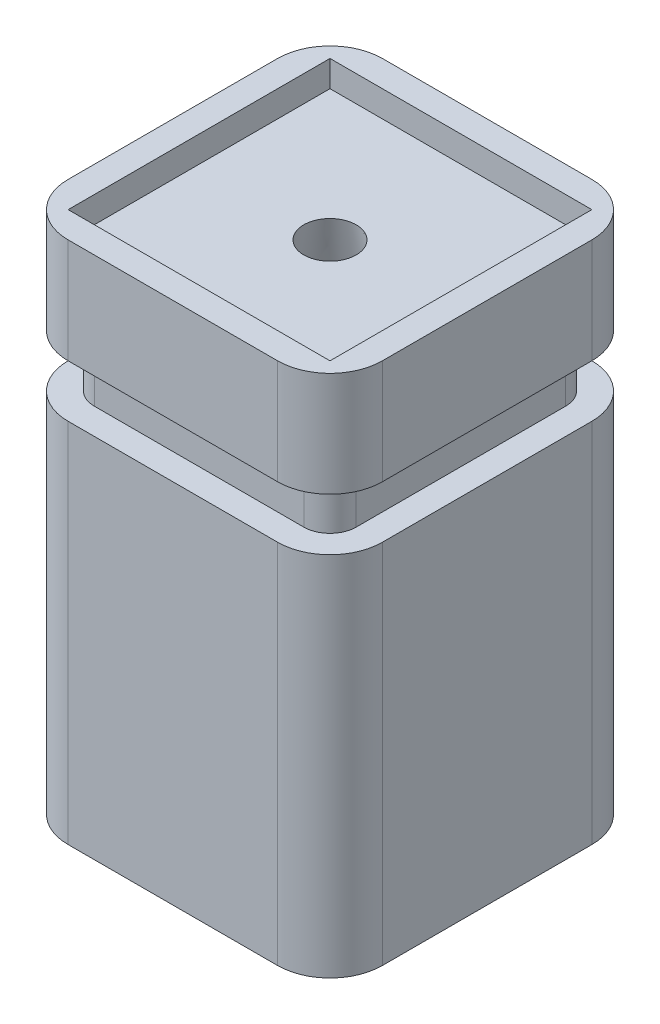
from build123d import *

# Parameters (mm, degrees)
SKETCH2_W           = 30
SKETCH2_H           = 30
BOSS_EXTRUDE1_DEPTH = 50
SKETCH3_W           = 25
SKETCH3_H           = 25
CUT_EXTRUDE1_DEPTH  = 2.5
FILLET1_R           = 5
SKETCH9_R           = 19.95304153
CUT_EXTRUDE2_DEPTH  = 5


with BuildPart() as part:
    # Sketch2 → Boss-Extrude1 (new body)
    with BuildSketch(Plane(origin=(0, 0, 0), x_dir=(1, 0, 0), z_dir=(0, 1, 0))):
        Rectangle(SKETCH2_W, SKETCH2_H)
    extrude(amount=BOSS_EXTRUDE1_DEPTH)

    # Sketch3 → Cut-Extrude1 (cut)
    with BuildSketch(Plane(origin=(0, 50, 0), x_dir=(1, 0, 0), z_dir=(0, 1, 0))):
        Rectangle(SKETCH3_W, SKETCH3_H)
    extrude(amount=-CUT_EXTRUDE1_DEPTH, mode=Mode.SUBTRACT)

    # Fillet1
    fillet1_edges = [part.edges().sort_by_distance(p)[0] for p in [
        (15, 25, 15),
        (-15, 25, 15),
        (-15, 25, -15),
        (15, 25, -15),
    ]]
    fillet(fillet1_edges, radius=FILLET1_R)

    # Cut-Loft2: read off the stored shape, not the designer's step
    # Cut-Loft2: loft between two sections, ruled curve by curve
    cut_loft2_from = [
        Edge.make_bspline([(0, 0, -12.5), (-25, 0, -12.5), (-25, 0, 12.5), (0, 0, 12.5), (25, 0, 12.5), (25, 0, -12.5), (0, 0, -12.5)], [0, 0, 0, 0, 0.5, 0.5, 0.5, 1, 1, 1, 1], 3, [1, 0.333333333, 0.333333333, 1, 0.333333333, 0.333333333, 1]),
    ]
    cut_loft2_to = [
        Edge.make_bspline([(0.784484005, 47.5, -2.373728048), (-3.962972092, 47.5, -3.942696057), (-5.531940101, 47.5, 0.804760039), (-0.784484005, 47.5, 2.373728048), (3.962972092, 47.5, 3.942696057), (5.531940101, 47.5, -0.804760039), (0.784484005, 47.5, -2.373728048)], [0, 0, 0, 0, 0.5, 0.5, 0.5, 1, 1, 1, 1], 3, [1, 0.333333333, 0.333333333, 1, 0.333333333, 0.333333333, 1]),
    ]
    cut_loft2 = Solid(Shell([*[Face.make_surface_from_curves(cut_loft2_from[k], cut_loft2_to[k]) for k in range(1)], Face(Wire(cut_loft2_from)), Face(Wire(cut_loft2_to))]))
    add(cut_loft2, mode=Mode.SUBTRACT)

    # Sketch9 → Cut-Extrude2 (cut)
    with BuildSketch(Plane(origin=(0, 35, 0), x_dir=(1, 0, 0), z_dir=(0, 1, 0))):
        Circle(SKETCH9_R)
        with BuildLine():
            Line((12.5, -10), (12.5, 10))
            ThreePointArc((12.5, 10), (11.767766953, 11.767766953), (10, 12.5))
            Line((10, 12.5), (-10, 12.5))
            ThreePointArc((-10, 12.5), (-11.767766953, 11.767766953), (-12.5, 10))
            Line((-12.5, 10), (-12.5, -10))
            ThreePointArc((-12.5, -10), (-11.767766953, -11.767766953), (-10, -12.5))
            Line((-10, -12.5), (10, -12.5))
            ThreePointArc((10, -12.5), (11.767766953, -11.767766953), (12.5, -10))
        make_face(mode=Mode.SUBTRACT)
    extrude(amount=CUT_EXTRUDE2_DEPTH, mode=Mode.SUBTRACT)


solid = part.part
